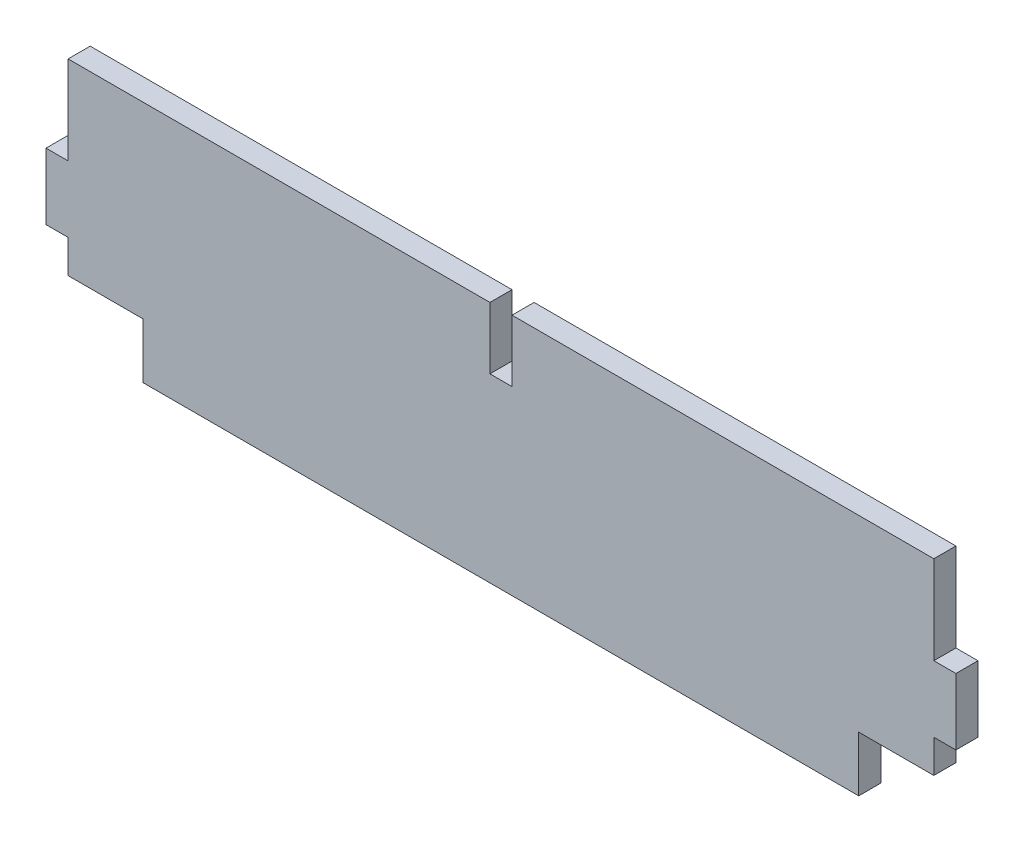
from build123d import *

# Parameters (mm, degrees)
BOSS_EXTRU_1_DEPTH      = 5
ESQUISSE2_W             = 17
ESQUISSE2_H             = 12.5
ENL_V_MAT_EXTRU_1_DEPTH = 209.449034538


with BuildPart() as part:
    # Esquisse1 → Boss.-Extru.1 (new body)
    with BuildSketch(Plane.XY):
        Polygon((0, 0), (196, 0), (196, 20), (201, 20), (201, 35), (196, 35), (196, 55), (100.5, 55), (100.5, 41), (95.5, 41), (95.5, 55), (0, 55), (0, 35), (-5, 35), (-5, 20), (0, 20), align=None)
    extrude(amount=BOSS_EXTRU_1_DEPTH)

    # Esquisse2 → Enlèv. mat.-Extru.1 (cut, through all)
    with BuildSketch(Plane.XY.offset(5)):
        with Locations((8.5, 6.25)):
            Rectangle(ESQUISSE2_W, ESQUISSE2_H)
        with Locations((187.5, 6.25)):
            Rectangle(ESQUISSE2_W, ESQUISSE2_H)
    extrude(amount=-ENL_V_MAT_EXTRU_1_DEPTH, mode=Mode.SUBTRACT)


solid = part.part
